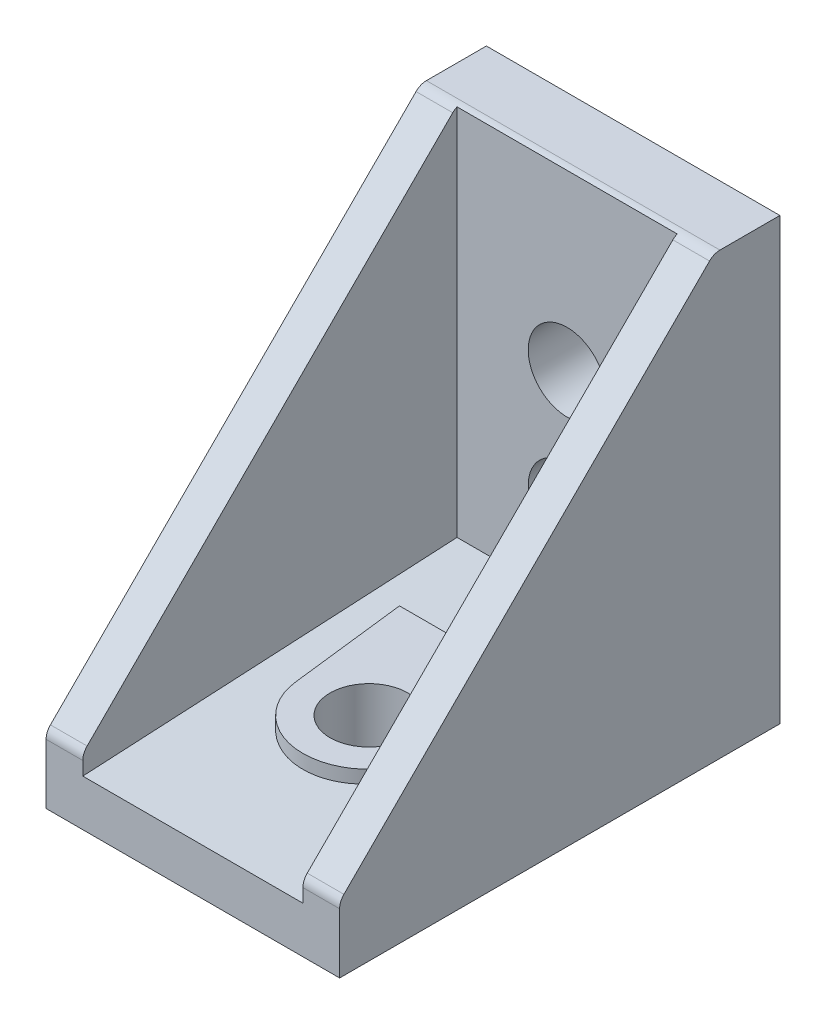
from build123d import *
from build123d.topology import SkipClean

# Parameters (mm, degrees)
BOSS_EXTRUDE1_DEPTH      = 10
BOSS_EXTRUDE1_DEPTH_BACK = 10
CUT_EXTRUDE1_DEPTH       = 7.5
CUT_EXTRUDE1_DEPTH_BACK  = 7.5
BOSS_EXTRUDE2_DEPTH      = 2.25
SKETCH4_R                = 2.65
CUT_EXTRUDE2_DEPTH       = 4.5
SKETCH5_R                = 2.65
CUT_EXTRUDE3_DEPTH       = 4.5
SKETCH6_R                = 2.65
CUT_EXTRUDE4_DEPTH       = 4.5
SKETCH7_W                = 20
SKETCH7_H                = 30
BOSS_EXTRUDE3_DEPTH      = 1
SKETCH8_W                = 20
SKETCH8_H                = 30
CUT_EXTRUDE5_DEPTH       = 1
SKETCH9_W                = 20
SKETCH9_H                = 30
BOSS_EXTRUDE4_DEPTH      = 1
CUT_EXTRUDE6_START       = -1
SKETCH10_W               = 20
SKETCH10_H               = 30
CUT_EXTRUDE6_DEPTH       = 1


with BuildPart() as part:
    # Sketch1 → Boss-Extrude1 (new, two sides: drawn at the far end of the back side and taken through both)
    with BuildSketch(Plane(origin=(0, 0, 0), x_dir=(0, 0, -1), z_dir=(1, 0, 0)).offset(-BOSS_EXTRUDE1_DEPTH_BACK)):
        with BuildLine():
            Line((-30, 0), (0, 0))
            Line((0, 0), (0, 30))
            Line((0, 30), (-4.085786438, 30))
            ThreePointArc((-4.085786438, 30), (-4.46846987, 29.923879533), (-4.792893219, 29.707106781))
            Line((-4.792893219, 29.707106781), (-29.707106781, 4.792893219))
            ThreePointArc((-29.707106781, 4.792893219), (-29.923879533, 4.46846987), (-30, 4.085786438))
            Line((-30, 4.085786438), (-30, 0))
        make_face()
    extrude(amount=BOSS_EXTRUDE1_DEPTH + BOSS_EXTRUDE1_DEPTH_BACK)

    # Sketch2 → Cut-Extrude1 (cut, two sides: drawn at the far end of the back side and taken through both)
    with BuildSketch(Plane(origin=(0, 0, 0), x_dir=(0, 0, -1), z_dir=(1, 0, 0)).offset(-CUT_EXTRUDE1_DEPTH_BACK)):
        Polygon((-34.5, 2.927766622), (-4.5, 4.5), (-4.5, 34.5), (-34.5, 34.5), align=None)
    extrude(amount=CUT_EXTRUDE1_DEPTH + CUT_EXTRUDE1_DEPTH_BACK, mode=Mode.SUBTRACT)

    # Sketch3 → Boss-Extrude2 (add)
    with BuildSketch(Plane(origin=(0, 4.5, 0), x_dir=(1, 0, 0), z_dir=(0, 1, 0))):
        with BuildLine():
            Line((-5.420884207, -10.5), (-4.4686916, -18.529901296))
            ThreePointArc((-4.4686916, -18.529901296), (0, -22.5), (4.4686916, -18.529901296))
            Line((4.4686916, -18.529901296), (5.420884207, -10.5))
            Line((5.420884207, -10.5), (-5.420884207, -10.5))
        make_face()
    extrude(amount=-BOSS_EXTRUDE2_DEPTH)

    # Sketch4 → Cut-Extrude2 (cut)
    with BuildSketch(Plane.XY):
        with Locations((0, 18)):
            Circle(SKETCH4_R)
    extrude(amount=CUT_EXTRUDE2_DEPTH, mode=Mode.SUBTRACT)

    # Sketch5 → Cut-Extrude3 (cut)
    with BuildSketch(Plane.XY):
        with Locations((0, 10)):
            Circle(SKETCH5_R)
    extrude(amount=CUT_EXTRUDE3_DEPTH, mode=Mode.SUBTRACT)

    # Sketch6 → Cut-Extrude4 (cut)
    with BuildSketch(Plane(origin=(0, 0, 0), x_dir=(1, 0, 0), z_dir=(0, 1, 0))):
        with Locations((0, -18)):
            Circle(SKETCH6_R)
    extrude(amount=CUT_EXTRUDE4_DEPTH, mode=Mode.SUBTRACT)

    # Sketch7 → Boss-Extrude3 (add)
    with BuildSketch(Plane(origin=(0, 0, 0), x_dir=(1, 0, 0), z_dir=(0, 1, 0))):
        with Locations((0, -15)):
            Rectangle(SKETCH7_W, SKETCH7_H)
    extrude(amount=-BOSS_EXTRUDE3_DEPTH)

    # Sketch8 → Cut-Extrude5 (cut)
    with BuildSketch(Plane(origin=(0, 0, 0), x_dir=(1, 0, 0), z_dir=(0, 1, 0))):
        with Locations((0, -15)):
            Rectangle(SKETCH8_W, SKETCH8_H)
        with BuildLine():
            Line((-2.7, -11), (2.7, -11))
            ThreePointArc((2.7, -11), (2.912132034, -10.912132034), (3, -10.7))
            Line((3, -10.7), (3, -5.3))
            ThreePointArc((3, -5.3), (2.912132034, -5.087867966), (2.7, -5))
            Line((2.7, -5), (-2.7, -5))
            ThreePointArc((-2.7, -5), (-2.912132034, -5.087867966), (-3, -5.3))
            Line((-3, -5.3), (-3, -10.7))
            ThreePointArc((-3, -10.7), (-2.912132034, -10.912132034), (-2.7, -11))
        make_face(mode=Mode.SUBTRACT)
        with BuildLine():
            Line((-2.7, -27), (2.7, -27))
            ThreePointArc((2.7, -27), (2.912132034, -26.912132034), (3, -26.7))
            Line((3, -26.7), (3, -24.3))
            ThreePointArc((3, -24.3), (2.912132034, -24.087867966), (2.7, -24))
            Line((2.7, -24), (-2.7, -24))
            ThreePointArc((-2.7, -24), (-2.912132034, -24.087867966), (-3, -24.3))
            Line((-3, -24.3), (-3, -26.7))
            ThreePointArc((-3, -26.7), (-2.912132034, -26.912132034), (-2.7, -27))
        make_face(mode=Mode.SUBTRACT)
    extrude(amount=-CUT_EXTRUDE5_DEPTH, mode=Mode.SUBTRACT)

    # Sketch9 → Boss-Extrude4 (add)
    with BuildSketch(Plane.XY):
        with Locations((0, 15)):
            Rectangle(SKETCH9_W, SKETCH9_H)
    extrude(amount=-BOSS_EXTRUDE4_DEPTH)

    # Sketch10 → Cut-Extrude6 (cut)
    with SkipClean():  # the faces are left unmerged after this step: merging them gives an invalid solid
        with BuildSketch(Plane.XY.offset(CUT_EXTRUDE6_START)):
            with Locations((0, 15)):
                Rectangle(SKETCH10_W, SKETCH10_H)
            with BuildLine():
                Line((0.5, 7), (2, 7))
                ThreePointArc((2, 7), (2.707106781, 7.292893219), (3, 8))
                Line((3, 8), (3, 9.5))
                Line((3, 9.5), (2.602402736, 9.5))
                ThreePointArc((2.602402736, 9.5), (1.87383297, 8.12616703), (0.5, 7.397597264))
                Line((0.5, 7.397597264), (0.5, 7))
            make_face(mode=Mode.SUBTRACT)
            with BuildLine():
                Line((0.5, 13), (0.5, 12.602402736))
                ThreePointArc((0.5, 12.602402736), (1.87383297, 11.87383297), (2.602402736, 10.5))
                Line((2.602402736, 10.5), (3, 10.5))
                Line((3, 10.5), (3, 12))
                ThreePointArc((3, 12), (2.707106781, 12.707106781), (2, 13))
                Line((2, 13), (0.5, 13))
            make_face(mode=Mode.SUBTRACT)
            with BuildLine():
                Line((-3, 9.5), (-3, 8))
                ThreePointArc((-3, 8), (-2.707106781, 7.292893219), (-2, 7))
                Line((-2, 7), (-0.5, 7))
                Line((-0.5, 7), (-0.5, 7.397597264))
                ThreePointArc((-0.5, 7.397597264), (-1.87383297, 8.12616703), (-2.602402736, 9.5))
                Line((-2.602402736, 9.5), (-3, 9.5))
            make_face(mode=Mode.SUBTRACT)
            with BuildLine():
                Line((-3, 10.5), (-2.602402736, 10.5))
                ThreePointArc((-2.602402736, 10.5), (-1.87383297, 11.87383297), (-0.5, 12.602402736))
                Line((-0.5, 12.602402736), (-0.5, 13))
                Line((-0.5, 13), (-2, 13))
                ThreePointArc((-2, 13), (-2.707106781, 12.707106781), (-3, 12))
                Line((-3, 12), (-3, 10.5))
            make_face(mode=Mode.SUBTRACT)
        extrude(amount=CUT_EXTRUDE6_DEPTH, mode=Mode.SUBTRACT)


solid = part.part
